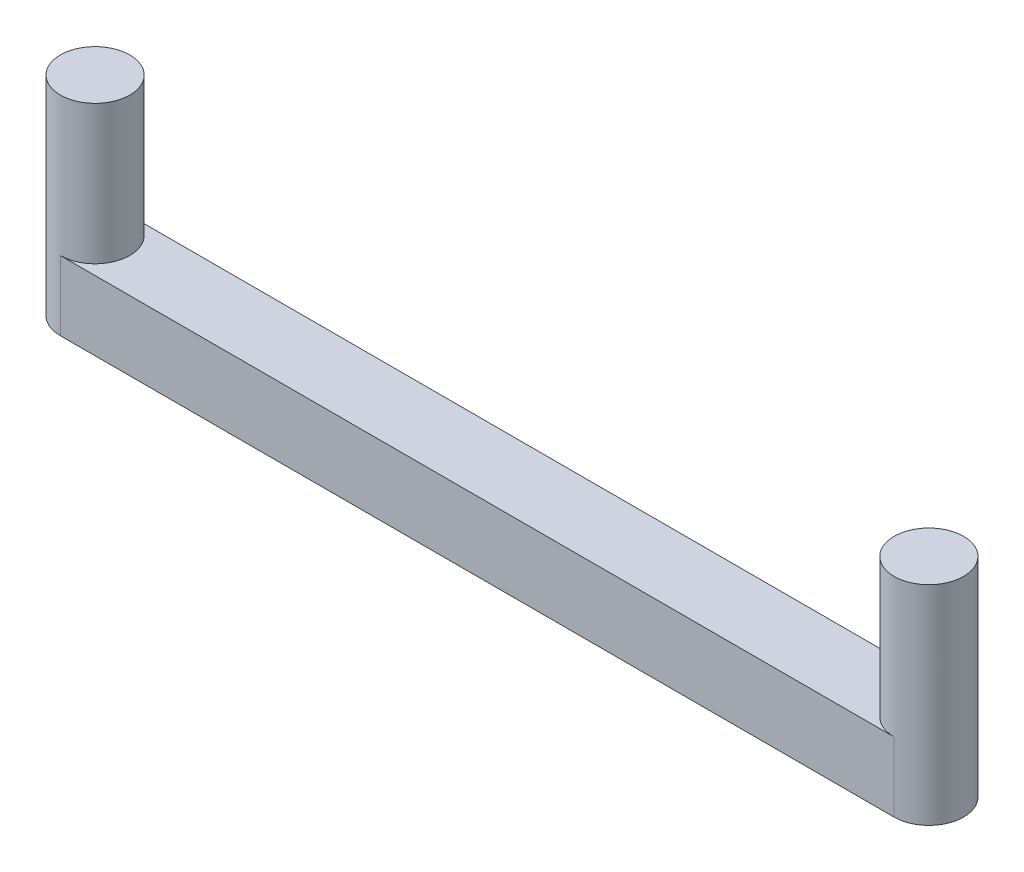
from build123d import *
from build123d.topology import SkipClean

# Parameters (mm, degrees)
SALIENTE_EXTRUIR1_DEPTH = 10
CROQUIS2_R              = 5
SALIENTE_EXTRUIR2_DEPTH = 20


with BuildPart() as part:
    # Croquis1 → Saliente-Extruir1 (new body)
    with BuildSketch(Plane(origin=(0, 0, 0), x_dir=(1, 0, 0), z_dir=(0, 1, 0))):
        with BuildLine():
            Line((-60, -34.207532581), (60, -34.207532581))
            ThreePointArc((60, -34.207532581), (65, -39.207532581), (60, -44.207532581))
            Line((60, -44.207532581), (-60, -44.207532581))
            ThreePointArc((-60, -44.207532581), (-65, -39.207532581), (-60, -34.207532581))
        make_face()
    extrude(amount=SALIENTE_EXTRUIR1_DEPTH)

    # Croquis2 → Saliente-Extruir2 (add)
    with SkipClean():  # the faces are left unmerged after this step: merging them gives an invalid solid
        with BuildSketch(Plane(origin=(0, 10, 0), x_dir=(1, 0, 0), z_dir=(0, 1, 0))):
            with Locations((60, -39.207532581)):
                Circle(CROQUIS2_R)
            with Locations((-60, -39.207532581)):
                Circle(CROQUIS2_R)
        extrude(amount=SALIENTE_EXTRUIR2_DEPTH)


solid = part.part
